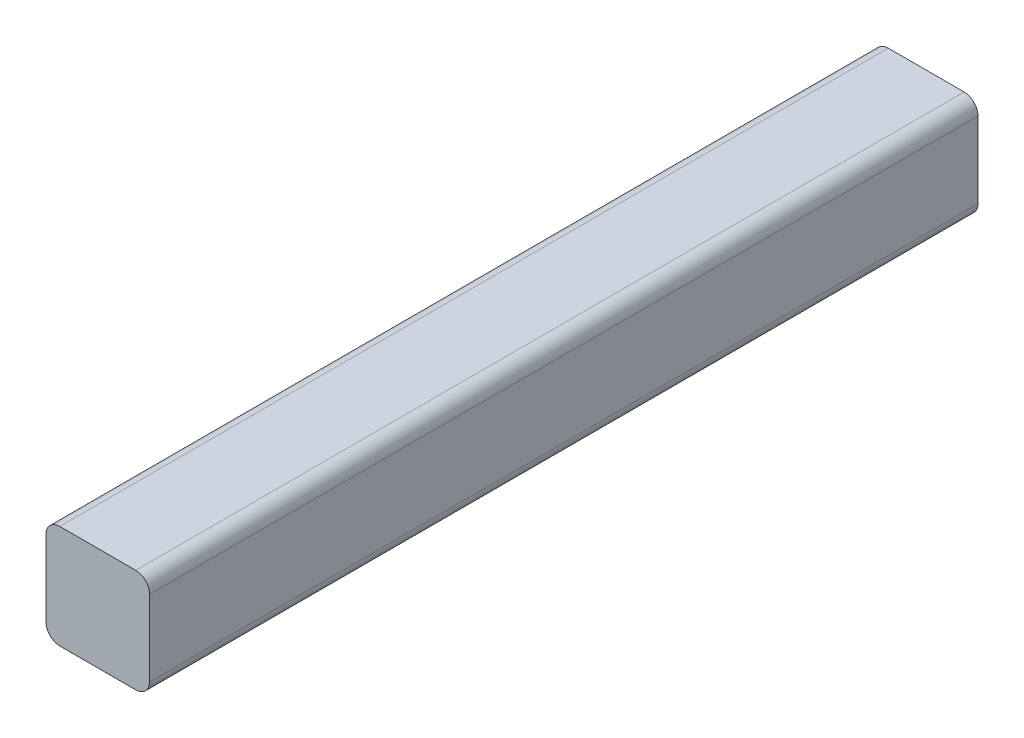
from build123d import *

# Parameters (mm, degrees)
SKETCH1_W           = 19.05
SKETCH1_H           = 19.05
BOSS_EXTRUDE1_DEPTH = 76.2
FILLET1_R           = 2.54


with BuildPart() as part:
    # Sketch1 → Boss-Extrude1 (new, symmetric)
    with BuildSketch(Plane.XY):
        Rectangle(SKETCH1_W, SKETCH1_H)
    extrude(amount=BOSS_EXTRUDE1_DEPTH, both=True)

    # Fillet1
    fillet1_edges = [part.edges().sort_by_distance(p)[0] for p in [
        (9.525, 9.525, 0),
        (-9.525, 9.525, 0),
        (-9.525, -9.525, 0),
        (9.525, -9.525, 0),
    ]]
    fillet(fillet1_edges, radius=FILLET1_R)


solid = part.part
